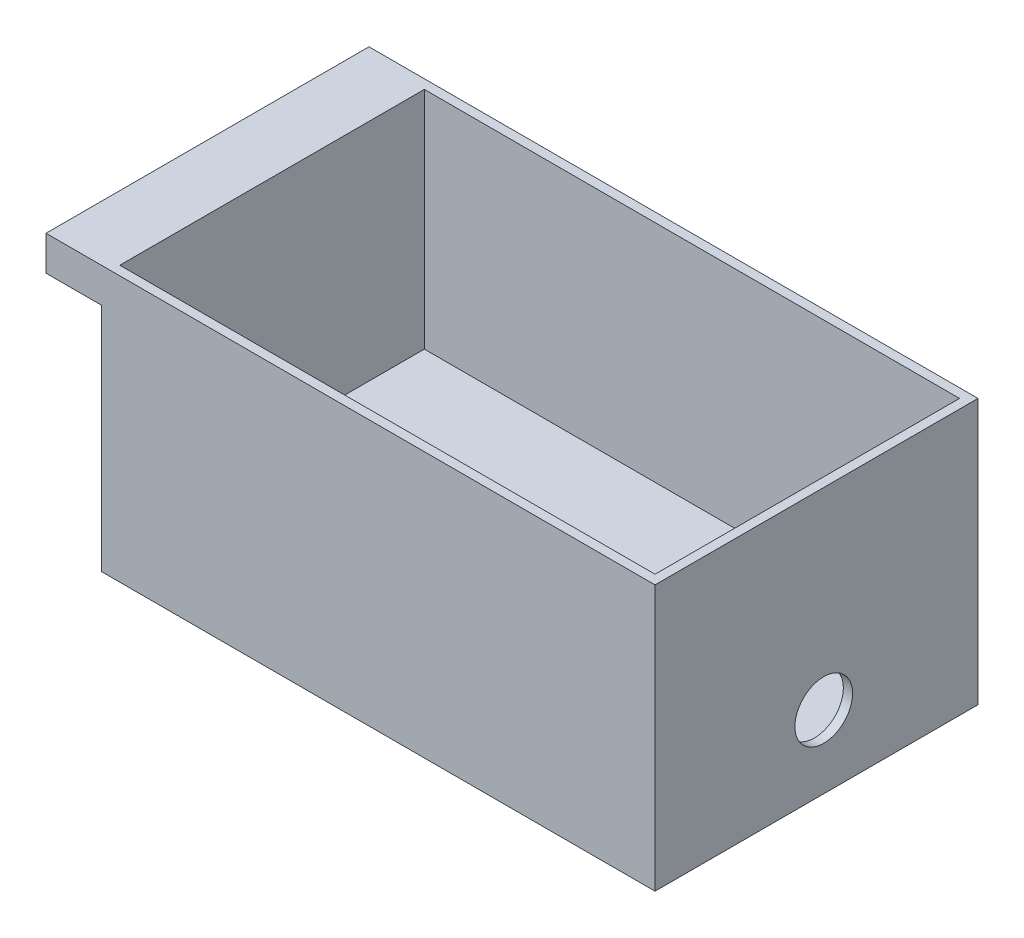
from build123d import *

# Parameters (mm, degrees)
SKETCH1_W           = 24
SKETCH1_H           = 14
BOSS_EXTRUDE1_DEPTH = 11.5
SKETCH2_W           = 23.2
SKETCH2_H           = 13.2
CUT_EXTRUDE1_DEPTH  = 9.75
SKETCH3_R           = 1.25
CUT_EXTRUDE2_DEPTH  = 3
SKETCH5_W           = 2.4
SKETCH5_H           = 14
BOSS_EXTRUDE2_DEPTH = 1.5


with BuildPart() as part:
    # Sketch1 → Boss-Extrude1 (new body)
    with BuildSketch(Plane(origin=(0, 0, 0), x_dir=(1, 0, 0), z_dir=(0, 1, 0))):
        with Locations((1.6, -1.057142857)):
            Rectangle(SKETCH1_W, SKETCH1_H)
    extrude(amount=BOSS_EXTRUDE1_DEPTH)

    # Sketch2 → Cut-Extrude1 (cut)
    with BuildSketch(Plane(origin=(0, 11.5, 0), x_dir=(1, 0, 0), z_dir=(0, 1, 0))):
        with Locations((1.6, -1.057142857)):
            Rectangle(SKETCH2_W, SKETCH2_H)
    extrude(amount=-CUT_EXTRUDE1_DEPTH, mode=Mode.SUBTRACT)

    # Sketch3 → Cut-Extrude2 (cut)
    with BuildSketch(Plane(origin=(13.6, 0, 0), x_dir=(0, 0, -1), z_dir=(1, 0, 0))):
        with Locations((-0.743835587, 3.147139599)):
            Circle(SKETCH3_R)
    extrude(amount=-CUT_EXTRUDE2_DEPTH, mode=Mode.SUBTRACT)

    # Sketch5 → Boss-Extrude2 (add)
    with BuildSketch(Plane(origin=(0, 11.5, 0), x_dir=(1, 0, 0), z_dir=(0, 1, 0))):
        with Locations((-11.6, -1.057142857)):
            Rectangle(SKETCH5_W, SKETCH5_H)
    extrude(amount=-BOSS_EXTRUDE2_DEPTH)


solid = part.part
